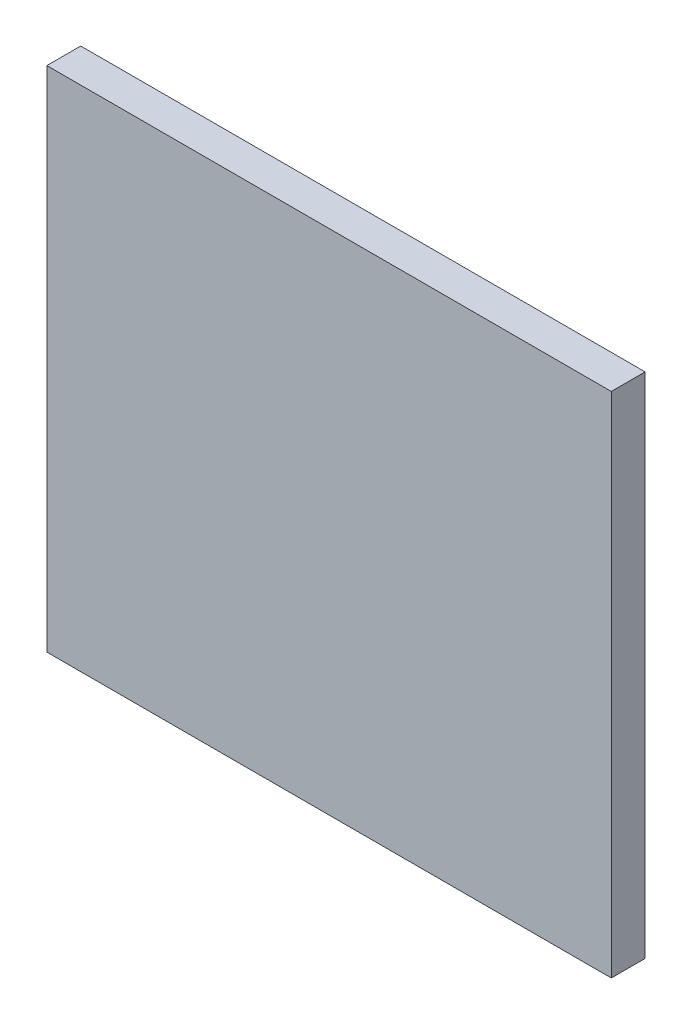
from build123d import *

# Parameters (mm, degrees)
SKETCH1_W           = 200
SKETCH1_H           = 180
BOSS_EXTRUDE1_DEPTH = 12


with BuildPart() as part:
    # Sketch1 → Boss-Extrude1 (new body)
    with BuildSketch(Plane.XY):
        Rectangle(SKETCH1_W, SKETCH1_H)
    extrude(amount=BOSS_EXTRUDE1_DEPTH)


solid = part.part
